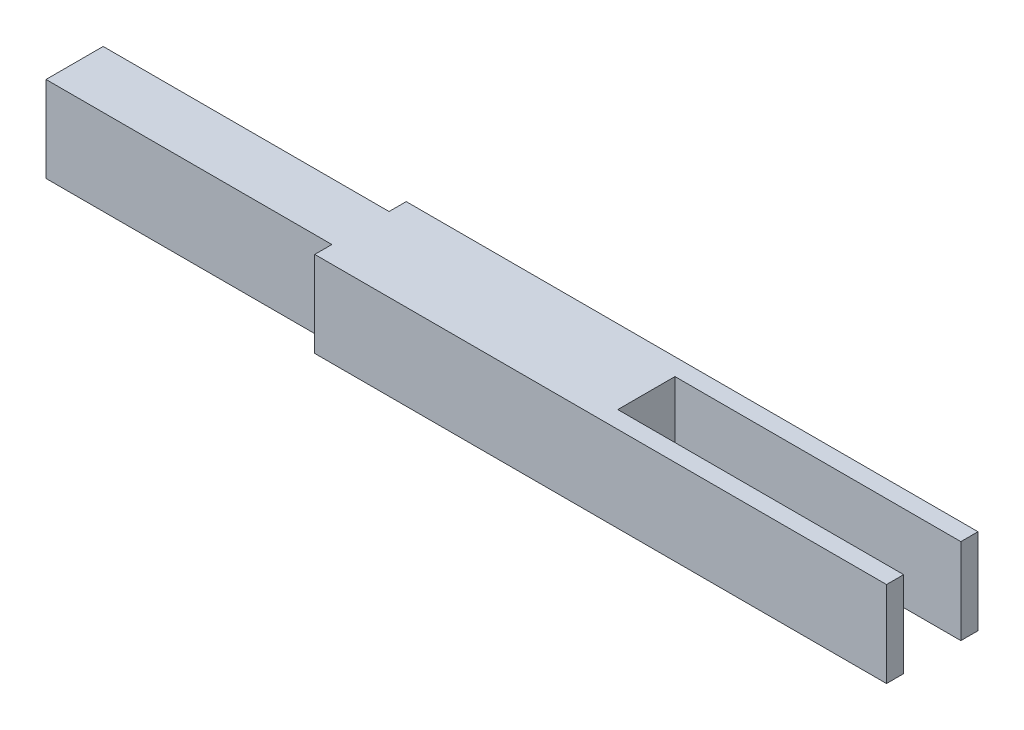
from build123d import *

# Parameters (mm, degrees)
BOSS_EXTRUDE1_DEPTH = 7.5


with BuildPart() as part:
    # Sketch1 → Boss-Extrude1 (new, symmetric)
    with BuildSketch(Plane(origin=(0, 0, 0), x_dir=(1, 0, 0), z_dir=(0, 1, 0))):
        Polygon((0, -5), (50, -5), (50, -8), (150, -8), (150, -5), (100, -5), (100, 5), (150, 5), (150, 8), (50, 8), (50, 5), (0, 5), align=None)
    extrude(amount=BOSS_EXTRUDE1_DEPTH, both=True)


solid = part.part
